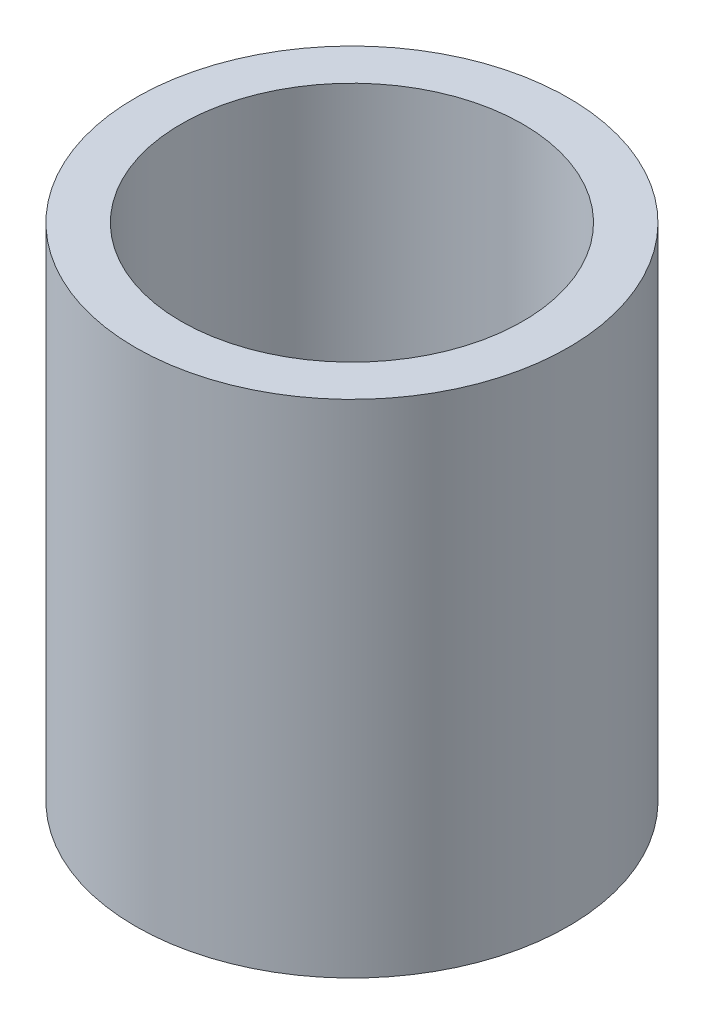
from build123d import *

# Parameters (mm, degrees)
SKETCH1_R           = 47.5
BOSS_EXTRUDE1_DEPTH = 110
SKETCH2_R           = 37.5
SKETCH2_R_2         = 5.25
BOSS_EXTRUDE2_DEPTH = 5


with BuildPart() as part:
    # Sketch1 → Boss-Extrude1 (new body)
    with BuildSketch(Plane(origin=(0, 0, 0), x_dir=(1, 0, 0), z_dir=(0, 1, 0))):
        Circle(SKETCH1_R)
        with BuildLine():
            ThreePointArc((37.5, 0), (0, -37.5), (-37.5, 0))
            ThreePointArc((-37.5, 0), (0, 37.5), (37.5, 0))
        make_face(mode=Mode.SUBTRACT)
    extrude(amount=BOSS_EXTRUDE1_DEPTH)

    # Sketch2 → Boss-Extrude2 (add)
    with BuildSketch(Plane.XZ):
        Circle(SKETCH2_R)
        Circle(SKETCH2_R_2, mode=Mode.SUBTRACT)
    extrude(amount=-BOSS_EXTRUDE2_DEPTH)


solid = part.part
